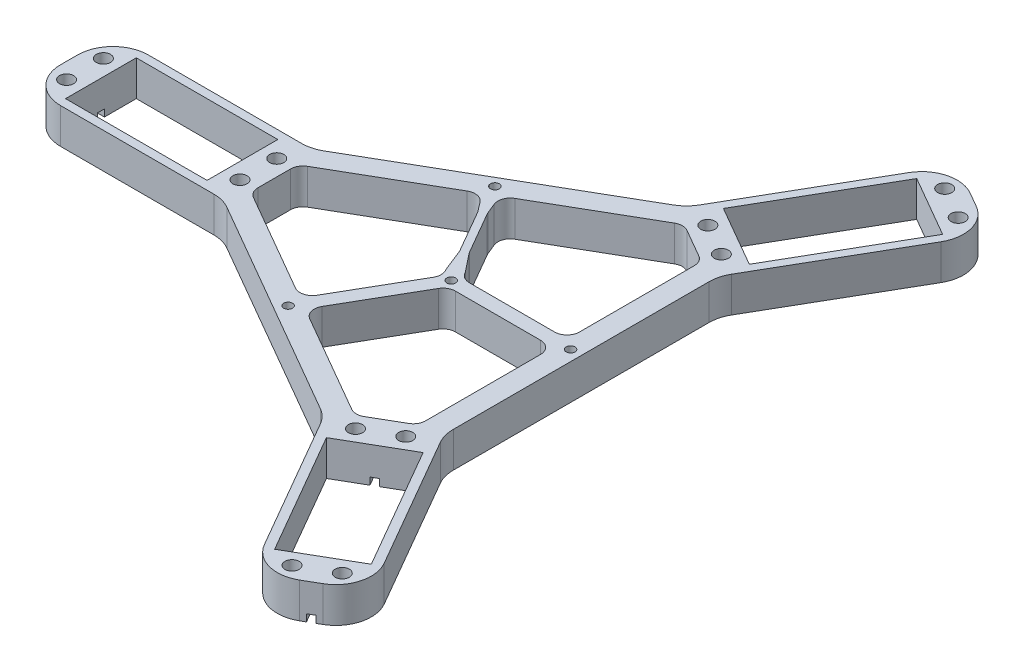
from build123d import *

# Parameters (mm, degrees)
SKETCH1_R           = 2
SKETCH1_W           = 40
SKETCH1_H           = 20
SKETCH1_R_2         = 1.25
BOSS_EXTRUDE1_DEPTH = 10
SKETCH2_W           = 2
SKETCH2_H           = 4
CUT_EXTRUDE1_DEPTH  = 56
CIRPATTERN1_COUNT   = 3
FILLET1_R           = 10
FILLET2_R           = 3.5


with BuildPart() as part:
    # Sketch1 → Boss-Extrude1 (new body)
    with BuildSketch(Plane(origin=(0, 0, 0), x_dir=(1, 0, 0), z_dir=(0, 1, 0))):
        Polygon((-9, 22.4), (-9, -2.4), (47, -2.4), (114.261284993, -41.233320997), (142.261284993, -89.730743609), (163.738715007, -77.330743609), (135.738715007, -28.833320997), (135.738715007, 48.833320997), (163.738715007, 97.330743609), (142.261284993, 109.730743609), (114.261284993, 61.233320997), (47, 22.4), align=None)
        Polygon((49, 16.626497308), (82.014634361, 35.687505343), (85.99611255, 30.523393759), (93.064765898, 18.280127019), (95.535898385, 12), (96.690598923, 10), (81.898591689, -15.620508076), (49, 3.373502692), align=None, mode=Mode.SUBTRACT)
        with Locations((-4.5, 4.8)):
            Circle(SKETCH1_R, mode=Mode.SUBTRACT)
        with Locations((44.5, 4.8)):
            Circle(SKETCH1_R, mode=Mode.SUBTRACT)
        with Locations((-4.5, 15.2)):
            Circle(SKETCH1_R, mode=Mode.SUBTRACT)
        with Locations((20, 10)):
            Rectangle(SKETCH1_W, SKETCH1_H, mode=Mode.SUBTRACT)
        with Locations((44.5, 15.2)):
            Circle(SKETCH1_R, mode=Mode.SUBTRACT)
        with Locations((82.130642497, 39.218584287)):
            Circle(SKETCH1_R_2, mode=Mode.SUBTRACT)
        with Locations((82.130642497, -19.218584287)):
            Circle(SKETCH1_R_2, mode=Mode.SUBTRACT)
        Polygon((129.738715007, 49.988021535), (129.738715007, 12), (100.154700538, 12), (99, 14), (94.796816706, 19.280127019), (87.728163358, 31.523393759), (85.246650633, 37.553510808), (118.261284993, 56.614518843), align=None, mode=Mode.SUBTRACT)
        with Locations((121.7466679, 59.798384506)):
            Circle(SKETCH1_R, mode=Mode.SUBTRACT)
        with Locations((130.7533321, 54.598384506)):
            Circle(SKETCH1_R, mode=Mode.SUBTRACT)
        Polygon((119.839745962, 66.095498823), (139.839745962, 100.736514975), (157.160254038, 90.736514975), (137.160254038, 56.095498823), align=None, mode=Mode.SUBTRACT)
        with Locations((155.2533321, 97.033629292)):
            Circle(SKETCH1_R, mode=Mode.SUBTRACT)
        with Locations((146.2466679, 102.233629292)):
            Circle(SKETCH1_R, mode=Mode.SUBTRACT)
        Polygon((118.261284993, -36.614518843), (85.362693304, -17.620508076), (100.154700538, 8), (129.738715007, 8), (129.738715007, -29.988021535), align=None, mode=Mode.SUBTRACT)
        with Locations((130.7533321, -34.598384506)):
            Circle(SKETCH1_R, mode=Mode.SUBTRACT)
        with Locations((146.2466679, -82.233629292)):
            Circle(SKETCH1_R, mode=Mode.SUBTRACT)
        with Locations((155.2533321, -77.033629292)):
            Circle(SKETCH1_R, mode=Mode.SUBTRACT)
        Polygon((137.160254038, -36.095498823), (157.160254038, -70.736514975), (139.839745962, -80.736514975), (119.839745962, -46.095498823), align=None, mode=Mode.SUBTRACT)
        with Locations((121.7466679, -39.798384506)):
            Circle(SKETCH1_R, mode=Mode.SUBTRACT)
        with Locations((132.738715007, 10)):
            Circle(SKETCH1_R_2, mode=Mode.SUBTRACT)
        with Locations((99, 10)):
            Circle(SKETCH1_R_2, mode=Mode.SUBTRACT)
    extrude(amount=BOSS_EXTRUDE1_DEPTH)

    # Sketch2 → Cut-Extrude1 (cut)
    with BuildSketch(Plane.ZY.offset(9)):
        with Locations((-10, 0)):
            Rectangle(SKETCH2_W, SKETCH2_H)
    cut_extrude1 = extrude(amount=-CUT_EXTRUDE1_DEPTH, mode=Mode.SUBTRACT)

    # CirPattern1: Cut-Extrude1 ×3 about axis
    cirpattern1_axis = Axis((99, 0, -10), (0, 1, 0))
    for i in range(1, CIRPATTERN1_COUNT):
        add(cut_extrude1.rotate(cirpattern1_axis, i * 360 / CIRPATTERN1_COUNT), mode=Mode.SUBTRACT)

    # Fillet1
    fillet1_edges = [part.edges().sort_by_distance(p)[0] for p in [
        (142.261284993, 5, -109.730743609),
        (163.738715007, 5, -97.330743609),
        (163.738715007, 5, 77.330743609),
        (142.261284993, 5, 89.730743609),
        (-9, 5, -22.4),
        (-9, 5, 2.4),
        (47, 5, -22.4),
        (114.261284993, 5, -61.233320997),
        (135.738715007, 5, -48.833320997),
        (135.738715007, 5, 28.833320997),
        (114.261284993, 5, 41.233320997),
        (47, 5, 2.4),
    ]]
    fillet(fillet1_edges, radius=FILLET1_R)

    # Fillet2
    fillet2_edges = [part.edges().sort_by_distance(p)[0] for p in [
        (129.738715007, 5, -8),
        (129.738715007, 5, 29.988021535),
        (118.261284993, 5, 36.614518843),
        (85.362693304, 5, 17.620508076),
        (129.738715007, 5, -12),
        (129.738715007, 5, -49.988021535),
        (118.261284993, 5, -56.614518843),
        (49, 5, -3.373502692),
        (81.898591689, 5, 15.620508076),
        (85.246650633, 5, -37.553510808),
        (87.728163358, 5, -31.523393759),
        (94.796816706, 5, -19.280127019),
        (99, 5, -14),
        (100.154700538, 5, -12),
        (96.690598923, 5, -10),
        (95.535898385, 5, -12),
        (93.064765898, 5, -18.280127019),
        (85.99611255, 5, -30.523393759),
        (82.014634361, 5, -35.687505343),
        (49, 5, -16.626497308),
        (100.154700538, 5, -8),
    ]]
    fillet(fillet2_edges, radius=FILLET2_R)


solid = part.part
